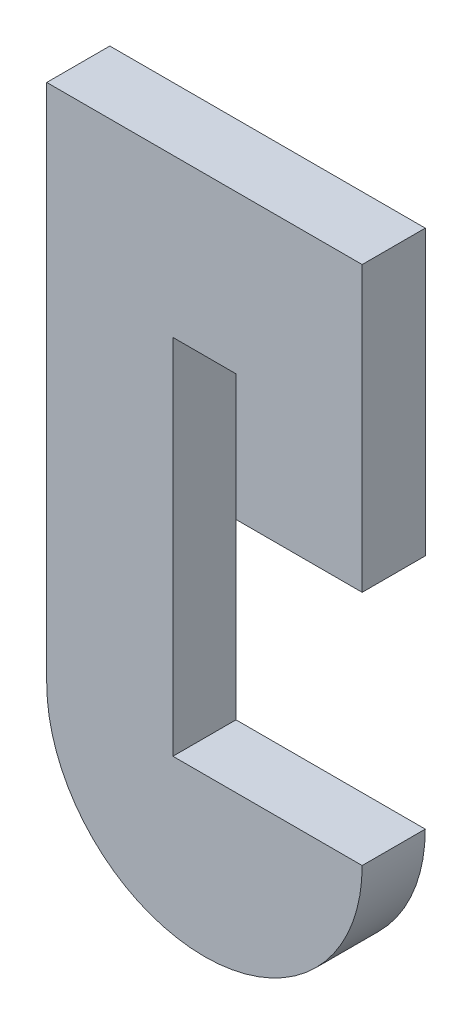
from build123d import *

# Parameters (mm, degrees)
SKETCH1_W           = 25.4
SKETCH1_H           = 54.61
BOSS_EXTRUDE1_DEPTH = 5.08
FILLET1_R           = 12.7
SKETCH2_W           = 15.24
SKETCH2_H           = 19.05
CUT_EXTRUDE1_DEPTH  = 12.7
SKETCH3_W           = 5.08
SKETCH3_H           = 10.16
CUT_EXTRUDE2_DEPTH  = 12.7


with BuildPart() as part:
    # Sketch1 → Boss-Extrude1 (new body)
    with BuildSketch(Plane.XY):
        Rectangle(SKETCH1_W, SKETCH1_H)
    extrude(amount=BOSS_EXTRUDE1_DEPTH)

    # Fillet1
    fillet1_edges = [part.edges().sort_by_distance(p)[0] for p in [
        (12.7, -27.305, 2.54),
        (-12.7, -27.305, 2.54),
    ]]
    fillet(fillet1_edges, radius=FILLET1_R - 0.0001)  # a hair under: the kernel refuses the full size

    # Sketch2 → Cut-Extrude1 (cut)
    with BuildSketch(Plane.XY.offset(5.08)):
        with Locations((5.08, -5.08)):
            Rectangle(SKETCH2_W, SKETCH2_H)
    extrude(amount=-CUT_EXTRUDE1_DEPTH, mode=Mode.SUBTRACT)

    # Sketch3 → Cut-Extrude2 (cut)
    with BuildSketch(Plane.XY.offset(5.08)):
        with Locations((0, 9.525)):
            Rectangle(SKETCH3_W, SKETCH3_H)
    extrude(amount=-CUT_EXTRUDE2_DEPTH, mode=Mode.SUBTRACT)


solid = part.part
